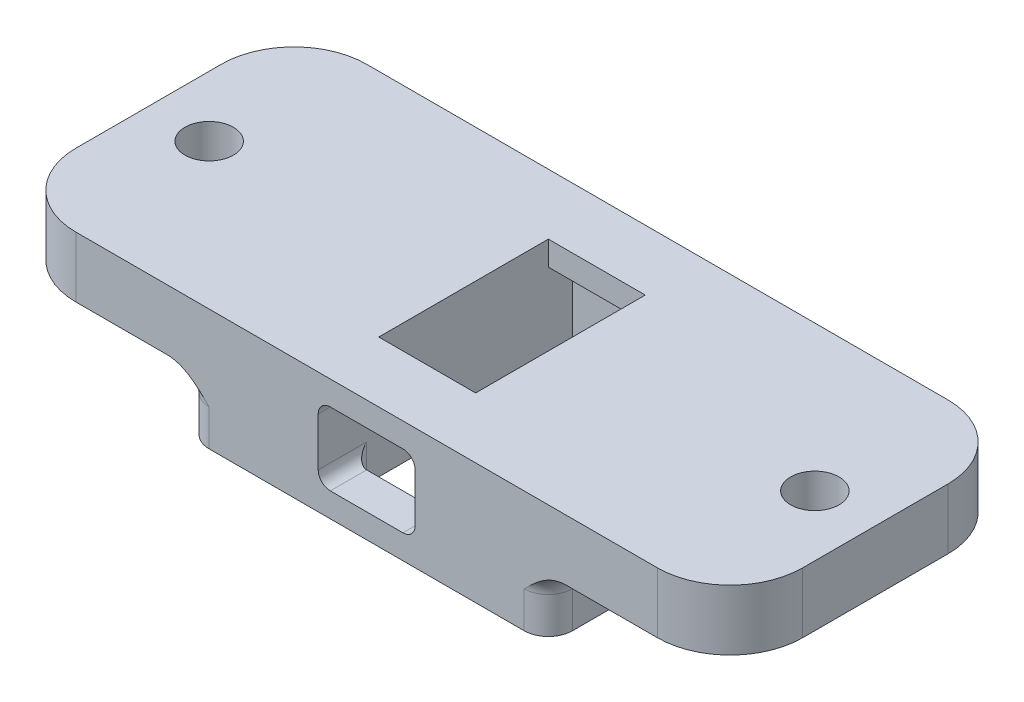
from build123d import *

# Parameters (mm, degrees)
SKETCH1_W           = 38.1
SKETCH1_H           = 30.48
SKETCH1_R           = 2.54
SKETCH1_W_2         = 10.16
SKETCH1_H_2         = 22.86
BOSS_EXTRUDE1_DEPTH = 12.7
SKETCH2_W           = 10.16
SKETCH2_H           = 2.54
BOSS_EXTRUDE2_DEPTH = 2.54
SKETCH3_W           = 10.16
SKETCH3_H           = 2.54
BOSS_EXTRUDE3_DEPTH = 2.54
FILLET1_R           = 2.54
SKETCH4_W           = 10.16
SKETCH4_H           = 7.62
CUT_EXTRUDE1_DEPTH  = 36.149415358
FILLET2_R           = 1.27
BOSS_EXTRUDE4_START = -6.35
SKETCH5_R           = 2.54
BOSS_EXTRUDE4_DEPTH = 6.35
SKETCH6_R           = 2.54
CUT_EXTRUDE2_DEPTH  = 43.955297694
FILLET3_R           = 7.62
FILLET4_R           = 2.54


with BuildPart() as part:
    # Sketch1 → Boss-Extrude1 (new body)
    with BuildSketch(Plane(origin=(0, 0, 0), x_dir=(1, 0, 0), z_dir=(0, 1, 0))):
        Rectangle(SKETCH1_W, SKETCH1_H)
        with Locations(Location((12.7, 0, 0), (0, 0, 270))):
            Circle(SKETCH1_R, mode=Mode.SUBTRACT)
        with Locations(Location((-12.7, 0, 0), (0, 0, 270))):
            Circle(SKETCH1_R, mode=Mode.SUBTRACT)
        Rectangle(SKETCH1_W_2, SKETCH1_H_2, mode=Mode.SUBTRACT)
    extrude(amount=-BOSS_EXTRUDE1_DEPTH)

    # Sketch2 → Boss-Extrude2 (add)
    with BuildSketch(Plane.XY.offset(-11.43)):
        with Locations((0, -1.27)):
            Rectangle(SKETCH2_W, SKETCH2_H)
    extrude(amount=BOSS_EXTRUDE2_DEPTH)

    # Sketch3 → Boss-Extrude3 (add)
    with BuildSketch(Plane(origin=(0, 0, 11.43), x_dir=(-1, 0, 0), z_dir=(0, 0, -1))):
        with Locations((0, -1.27)):
            Rectangle(SKETCH3_W, SKETCH3_H)
    extrude(amount=BOSS_EXTRUDE3_DEPTH)

    # Fillet1
    fillet1_edges = [part.edges().sort_by_distance(p)[0] for p in [
        (19.05, -6.35, 15.24),
        (-19.05, -6.35, 15.24),
        (-19.05, -6.35, -15.24),
        (19.05, -6.35, -15.24),
    ]]
    fillet(fillet1_edges, radius=FILLET1_R)

    # Sketch4 → Cut-Extrude1 (cut, through all)
    with BuildSketch(Plane(origin=(0, 0, 11.43), x_dir=(-1, 0, 0), z_dir=(0, 0, -1))):
        with Locations((0, -6.35)):
            Rectangle(SKETCH4_W, SKETCH4_H)
    extrude(amount=-CUT_EXTRUDE1_DEPTH, mode=Mode.SUBTRACT)

    # Fillet2
    fillet2_edges = [part.edges().sort_by_distance(p)[0] for p in [
        (-5.08, -11.43, 11.43),
        (5.08, -11.43, 11.43),
        (-5.08, -2.54, 12.065),
        (5.08, -2.54, 12.065),
        (5.08, -10.16, 13.335),
        (-5.08, -10.16, 13.335),
    ]]
    fillet(fillet2_edges, radius=FILLET2_R)

    # Sketch5 → Boss-Extrude4 (add)
    with BuildSketch(Plane(origin=(0, 0, 0), x_dir=(1, 0, 0), z_dir=(0, 1, 0)).offset(BOSS_EXTRUDE4_START)):
        with BuildLine():
            Line((-16.51, 15.24), (-38.1, 15.24))
            Line((-38.1, 15.24), (-38.1, -15.24))
            Line((-38.1, -15.24), (-16.51, -15.24))
            ThreePointArc((-16.51, -15.24), (-18.306051224, -14.496051224), (-19.05, -12.7))
            Line((-19.05, -12.7), (-19.05, 12.7))
            ThreePointArc((-19.05, 12.7), (-18.306051224, 14.496051224), (-16.51, 15.24))
        make_face()
        with BuildLine():
            Line((38.1, 15.24), (16.51, 15.24))
            ThreePointArc((16.51, 15.24), (18.306051224, 14.496051224), (19.05, 12.7))
            Line((19.05, 12.7), (19.05, -12.7))
            ThreePointArc((19.05, -12.7), (18.306051224, -14.496051224), (16.51, -15.24))
            Line((16.51, -15.24), (38.1, -15.24))
            Line((38.1, -15.24), (38.1, 15.24))
        make_face()
        with Locations(Location((12.7, 0, 0), (0, 0, 270))):
            Circle(SKETCH5_R)
        with Locations(Location((-12.7, 0, 0), (0, 0, 270))):
            Circle(SKETCH5_R)
    extrude(amount=BOSS_EXTRUDE4_DEPTH)

    # Sketch6 → Cut-Extrude2 (cut, through all)
    with BuildSketch(Plane(origin=(0, 0, 0), x_dir=(1, 0, 0), z_dir=(0, 1, 0))):
        with Locations(Location((-31.75, 0, 0), (0, 0, 270))):
            Circle(SKETCH6_R)
        with Locations(Location((31.75, 0, 0), (0, 0, 270))):
            Circle(SKETCH6_R)
    extrude(amount=-CUT_EXTRUDE2_DEPTH, mode=Mode.SUBTRACT)

    # Fillet3
    fillet3_edges = [part.edges().sort_by_distance(p)[0] for p in [
        (38.1, -3.175, 15.24),
        (-38.1, -3.175, 15.24),
        (-38.1, -3.175, -15.24),
        (38.1, -3.175, -15.24),
    ]]
    fillet(fillet3_edges, radius=FILLET3_R)

    # Fillet4
    # the kernel refuses this fillet: 2.54 mm, written as the material it adds along each edge
    with BuildSketch(Plane(origin=(-16.51, -6.35, -12.7), x_dir=(-1, 0, 0), z_dir=(0, 0, 1))) as fillet4_piece_1_section:
        with BuildLine():
            CenterArc((2.54 + FILLET4_R, FILLET4_R), FILLET4_R, 180, 90)
            Line((2.54, FILLET4_R), (2.54, 0))
            Line((2.54, 0), (2.54 + FILLET4_R, 0))
        make_face()
    fillet4_piece_1 = revolve(axis=Axis((-16.51, -6.35, -12.7), (0, -1, 0)), revolution_arc=233.296989237, mode=Mode.PRIVATE)
    fillet4_piece_1 = split(fillet4_piece_1, bisect_by=Plane(origin=(-19.608229137, -6.77494251, -15.24), z_dir=(0, 0, 1)), keep=Keep.TOP, mode=Mode.PRIVATE)
    add(fillet4_piece_1)
    with BuildSketch(Plane(origin=(16.51, -6.35, 12.7), x_dir=(1, 0, 0), z_dir=(0, 0, -1))) as fillet4_piece_2_section:
        with BuildLine():
            CenterArc((2.54 + FILLET4_R, FILLET4_R), FILLET4_R, 180, 90)
            Line((2.54, FILLET4_R), (2.54, 0))
            Line((2.54, 0), (2.54 + FILLET4_R, 0))
        make_face()
    fillet4_piece_2 = revolve(axis=Axis((16.51, -6.35, 12.7), (0, -1, 0)), revolution_arc=233.296989237, mode=Mode.PRIVATE)
    fillet4_piece_2 = split(fillet4_piece_2, bisect_by=Plane(origin=(19.608229137, -6.77494251, 15.24), z_dir=(0, 0, -1)), keep=Keep.TOP, mode=Mode.PRIVATE)
    add(fillet4_piece_2)
    with BuildSketch(Plane(origin=(-16.51, -6.35, 12.7), x_dir=(0.5976672776328222, 0, -0.8017442392976523), z_dir=(-0.8017442392976523, 0, -0.5976672776328222))) as fillet4_piece_3_section:
        with BuildLine():
            CenterArc((2.54 + FILLET4_R, FILLET4_R), FILLET4_R, 180, 90)
            Line((2.54, FILLET4_R), (2.54, 0))
            Line((2.54, 0), (2.54 + FILLET4_R, 0))
        make_face()
    fillet4_piece_3 = revolve(axis=Axis((-16.51, -6.35, 12.7), (0, -1, 0)), revolution_arc=233.296989237, mode=Mode.PRIVATE)
    fillet4_piece_3 = split(fillet4_piece_3, bisect_by=Plane(origin=(-18.414845025, -7.141535935, 15.24), z_dir=(0, 0, -1)), keep=Keep.TOP, mode=Mode.PRIVATE)
    add(fillet4_piece_3)
    with BuildSketch(Plane(origin=(-19.05, -6.35, 12.7), x_dir=(-1, 0, 0), z_dir=(0, 0, -1)), Plane(origin=(19.05, -6.35, -12.7), x_dir=(1, 0, 0), z_dir=(0, 0, 1))) as fillet4_piece_4:
        with BuildLine():
            CenterArc((FILLET4_R, -FILLET4_R), FILLET4_R, 90, 90)
            Line((0, -FILLET4_R), (0, 0))
            Line((0, 0), (FILLET4_R, 0))
        make_face()
    extrude(amount=25.4)
    with BuildSketch(Plane(origin=(16.51, -6.35, -12.7), x_dir=(-0.5976672776328322, 0, 0.8017442392976448), z_dir=(0.8017442392976448, 0, 0.5976672776328322))) as fillet4_piece_5_section:
        with BuildLine():
            CenterArc((2.54 + FILLET4_R, FILLET4_R), FILLET4_R, 180, 90)
            Line((2.54, FILLET4_R), (2.54, 0))
            Line((2.54, 0), (2.54 + FILLET4_R, 0))
        make_face()
    fillet4_piece_5 = revolve(axis=Axis((16.51, -6.35, -12.7), (0, -1, 0)), revolution_arc=233.296989237, mode=Mode.PRIVATE)
    fillet4_piece_5 = split(fillet4_piece_5, bisect_by=Plane(origin=(18.414845035, -7.141535946, -15.24), z_dir=(0, 0, 1)), keep=Keep.TOP, mode=Mode.PRIVATE)
    add(fillet4_piece_5)


solid = part.part
